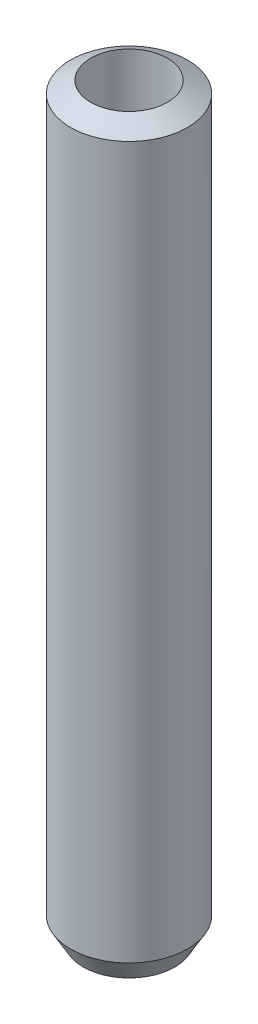
from build123d import *

# Parameters (mm, degrees)
SKETCH1_R           = 17.5
BOSS_EXTRUDE1_DEPTH = 223.172952
SKETCH2_R           = 11.457461293
CUT_EXTRUDE1_DEPTH  = 225.541012967
CHAMFER1_SIZE       = 3.792497
CHAMFER1_SIZE_2     = 6.568797


with BuildPart() as part:
    # Sketch1 → Boss-Extrude1 (new body)
    with BuildSketch(Plane(origin=(0, 0, 0), x_dir=(1, 0, 0), z_dir=(0, 1, 0))):
        with Locations(Location((0, 0, 0), (0, 0, 270))):
            Circle(SKETCH1_R)
    extrude(amount=BOSS_EXTRUDE1_DEPTH)

    # Sketch2 → Cut-Extrude1 (cut, through all)
    with BuildSketch(Plane(origin=(0, 0, 0), x_dir=(1, 0, 0), z_dir=(0, 1, 0))):
        with Locations(Location((0, 0, 0), (0, 0, 270))):
            Circle(SKETCH2_R)
    extrude(amount=CUT_EXTRUDE1_DEPTH, mode=Mode.SUBTRACT)

    # Chamfer1
    # the kernel refuses this chamfer: 6.568797, 3.792497 mm, written as the material it takes off along each edge
    with BuildSketch(Plane(origin=(0, 223.172952, 0), x_dir=(0, 0, 1), z_dir=(-1, 0, 0))) as chamfer1_piece_1:
        Polygon((17.5, -CHAMFER1_SIZE), (17.5 - CHAMFER1_SIZE_2, 0), (17.5, 0), align=None)
    revolve(axis=Axis((0, 223.172952, 0), (0, 1, 0)), mode=Mode.SUBTRACT)
    with BuildSketch(Plane(origin=(0, 0, 0), x_dir=(0, 0, 1), z_dir=(-1, 0, 0))) as chamfer1_piece_2:
        Polygon((17.5, CHAMFER1_SIZE_2), (17.5 - CHAMFER1_SIZE, 0), (17.5, 0), align=None)
    revolve(axis=Axis((0, 0, 0), (0, 1, 0)), mode=Mode.SUBTRACT)


solid = part.part
